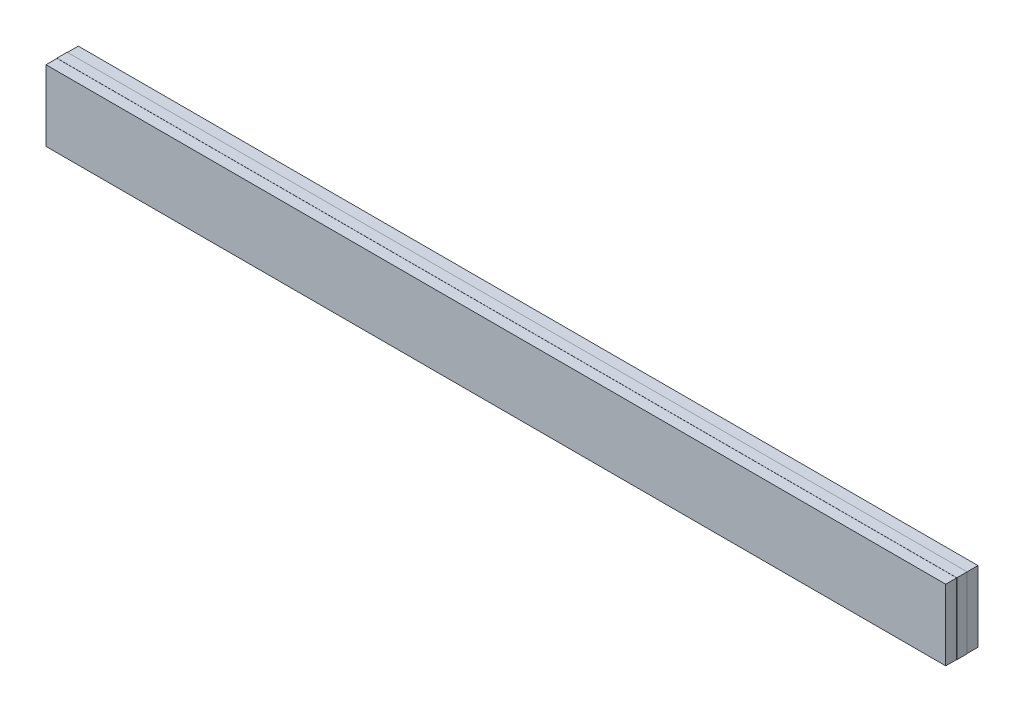
from build123d import *

# Parameters (mm, degrees)
SKETCH1_W           = 69.7
SKETCH1_H           = 5.5
BOSS_EXTRUDE1_DEPTH = 0.4
SKETCH2_W           = 69.68
SKETCH2_H           = 5.48
BOSS_EXTRUDE2_DEPTH = 0.85
SKETCH3_W           = 69.68
SKETCH3_H           = 5.48
BOSS_EXTRUDE3_DEPTH = 0.85


with BuildPart() as part:
    # Sketch1 → Boss-Extrude1 (new, symmetric)
    with BuildSketch(Plane.XY):
        Rectangle(SKETCH1_W, SKETCH1_H)
    extrude(amount=BOSS_EXTRUDE1_DEPTH, both=True)

    # Sketch2 → Boss-Extrude2 (add)
    with BuildSketch(Plane.XY.offset(0.4)):
        Rectangle(SKETCH2_W, SKETCH2_H)
    extrude(amount=BOSS_EXTRUDE2_DEPTH)

    # Sketch3 → Boss-Extrude3 (add)
    with BuildSketch(Plane(origin=(0, 0, -0.4), x_dir=(-1, 0, 0), z_dir=(0, 0, -1))):
        Rectangle(SKETCH3_W, SKETCH3_H)
    extrude(amount=BOSS_EXTRUDE3_DEPTH)


solid = part.part
